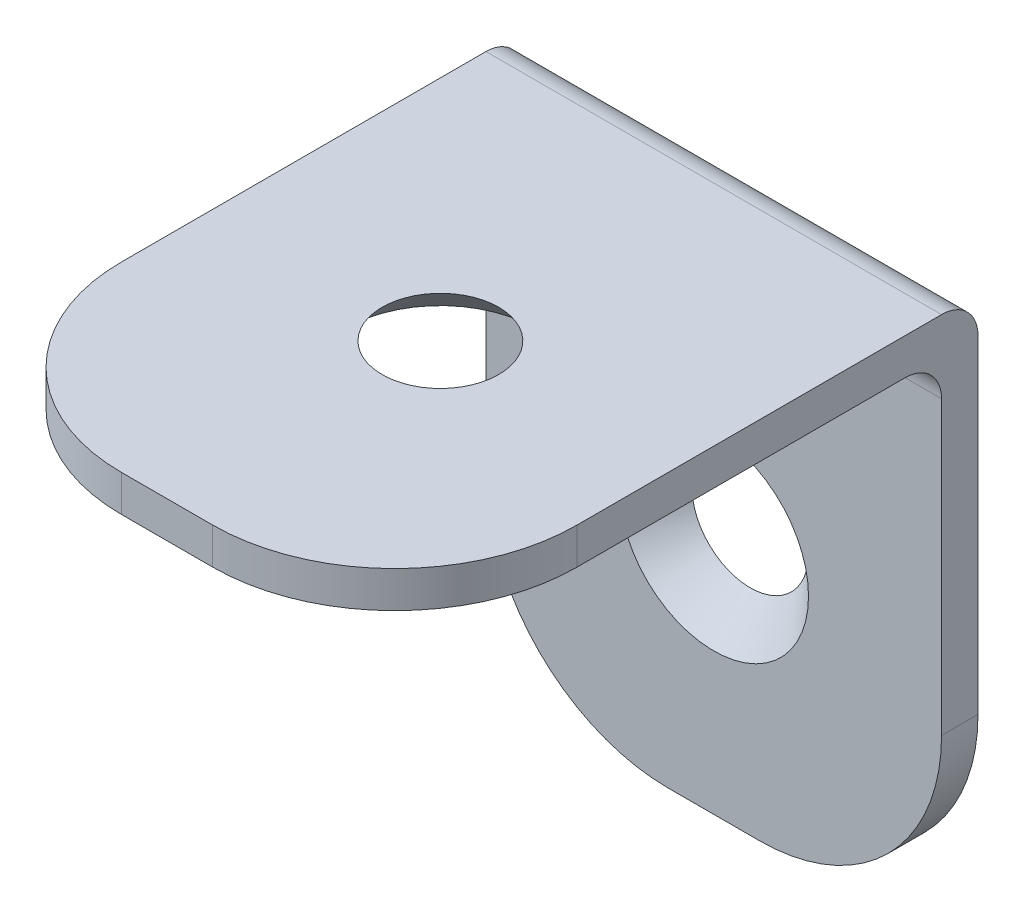
from build123d import *

# Parameters (mm, degrees)
EXTRUDE_1_DEPTH = 2
EXTRUDE_2_DEPTH = 2
FILLET_1_R      = 2
FILLET_2_R      = 2


with BuildPart() as part:
    # Эскиз1 → Бобышка-Вытянуть1 (new body)
    with BuildSketch(Plane(origin=(0, 0, 0), x_dir=(1, 0, 0), z_dir=(0, 1, 0))):
        with BuildLine():
            Line((-2.5, -15), (2.5, -15))
            ThreePointArc((2.5, -15), (9.571067812, -12.071067812), (12.5, -5))
            Line((12.5, -5), (12.5, 15))
            Line((12.5, 15), (-12.5, 15))
            Line((-12.5, 15), (-12.5, -5))
            ThreePointArc((-12.5, -5), (-9.571067812, -12.071067812), (-2.5, -15))
        make_face()
    extrude(amount=EXTRUDE_1_DEPTH)

    # Эскиз3 → Бобышка-Вытянуть2 (add)
    with BuildSketch(Plane(origin=(0, 0, -15), x_dir=(-1, 0, 0), z_dir=(0, 0, -1))):
        with BuildLine():
            Line((-2.5, -28), (2.5, -28))
            ThreePointArc((2.5, -28), (9.571067812, -25.071067812), (12.5, -18))
            Line((12.5, -18), (12.5, 2))
            Line((12.5, 2), (-12.5, 2))
            Line((-12.5, 2), (-12.5, -18))
            ThreePointArc((-12.5, -18), (-9.571067812, -25.071067812), (-2.5, -28))
        make_face()
    extrude(amount=EXTRUDE_2_DEPTH)

    # Скругление1
    fillet_1_edges = [part.edges().sort_by_distance(p)[0] for p in [
        (0, 0, -15),
    ]]
    fillet(fillet_1_edges, radius=FILLET_1_R)

    # Скругление2
    fillet_2_edges = [part.edges().sort_by_distance(p)[0] for p in [
        (0, 2, -17),
    ]]
    fillet(fillet_2_edges, radius=FILLET_2_R)

    # Эскиз7 → Зенковка для винта с полупотайной головкой M52 (revolve, cut)
    with BuildSketch(Plane(origin=(0, -15.034247801, -15), x_dir=(0, -1, 0), z_dir=(1, 0, 0))):
        Polygon((0, 0), (0, 2), (2.75, 2), (2.75, 2.45), (5.2, 0), align=None)
    revolve(axis=Axis((0, -15.034247801, -8.65), (0, 0, -1)), mode=Mode.SUBTRACT)

    # Эскиз9 → Зенковка для винта с полупотайной головкой M53 (revolve, cut)
    with BuildSketch(Plane(origin=(0, 0, 0), x_dir=(0, 0, -1), z_dir=(1, 0, 0))):
        Polygon((0, 0), (0, 2), (2.75, 2), (2.75, 2.45), (5.2, 0), align=None)
    revolve(axis=Axis((0, -6.35, 0), (0, 1, 0)), mode=Mode.SUBTRACT)


solid = part.part
